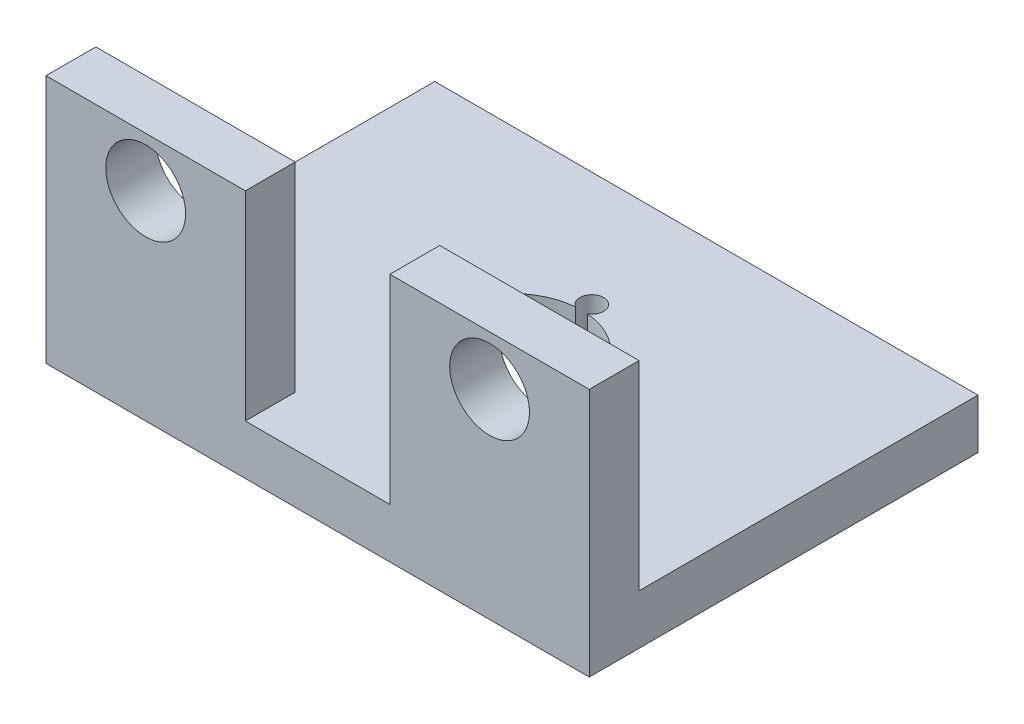
from build123d import *

# Parameters (mm, degrees)
SKETCH1_W                = 54.5
SKETCH1_H                = 39
BOSS_EXTRUDE1_DEPTH      = 5
SKETCH10_R               = 7
CUT_EXTRUDE1_DEPTH       = 5
M2_CLEARANCE_HOLE1_D     = 2.4
M2_CLEARANCE_HOLE1_DEPTH = 17
M2_CLEARANCE_HOLE1_TIP   = 0.721032743
SKETCH12_W               = 20
SKETCH12_H               = 5
BOSS_EXTRUDE2_DEPTH      = 20
SKETCH13_R               = 4
CUT_EXTRUDE2_DEPTH       = 5


with BuildPart() as part:
    # Sketch1 → Boss-Extrude1 (new body)
    with BuildSketch(Plane(origin=(0, 0, 0), x_dir=(1, 0, 0), z_dir=(0, 1, 0))):
        with Locations((-13.399543841, 8.129312584)):
            Rectangle(SKETCH1_W, SKETCH1_H)
    extrude(amount=BOSS_EXTRUDE1_DEPTH)

    # Sketch10 → Cut-Extrude1 (cut)
    with BuildSketch(Plane(origin=(0, 5, 0), x_dir=(1, 0, 0), z_dir=(0, 1, 0))):
        with Locations((-13.399543841, 8.129312584)):
            Circle(SKETCH10_R)
    extrude(amount=-CUT_EXTRUDE1_DEPTH, mode=Mode.SUBTRACT)

    # M2 Clearance Hole1
    with Locations(Plane(origin=(-13.399543841, 5, -0.129312584), x_dir=(0, 0, 1), z_dir=(0, 1, 0))):
        with Locations((0, 0), (-8, 7.99475453), (-8, -7.99475453), (-16, 0)):
            Hole(M2_CLEARANCE_HOLE1_D / 2, depth=M2_CLEARANCE_HOLE1_DEPTH)
            with Locations((0, 0, -(M2_CLEARANCE_HOLE1_DEPTH + M2_CLEARANCE_HOLE1_TIP / 2))):  # 118° drill point
                Cone(0, M2_CLEARANCE_HOLE1_D / 2, M2_CLEARANCE_HOLE1_TIP, mode=Mode.SUBTRACT)

    # Sketch12 → Boss-Extrude2 (add)
    with BuildSketch(Plane(origin=(0, 5, 0), x_dir=(1, 0, 0), z_dir=(0, 1, 0))):
        with Locations((3.850456159, -8.870687416)):
            Rectangle(SKETCH12_W, SKETCH12_H)
        with Locations((-30.649543841, -8.870687416)):
            Rectangle(SKETCH12_W, SKETCH12_H)
    extrude(amount=BOSS_EXTRUDE2_DEPTH)

    # Sketch13 → Cut-Extrude2 (cut)
    with BuildSketch(Plane(origin=(0, 0, 6.370687416), x_dir=(-1, 0, 0), z_dir=(0, 0, -1))):
        with Locations((-3.850456159, 20)):
            Circle(SKETCH13_R)
        with Locations((30.649543841, 20)):
            Circle(SKETCH13_R)
    extrude(amount=-CUT_EXTRUDE2_DEPTH, mode=Mode.SUBTRACT)


solid = part.part
